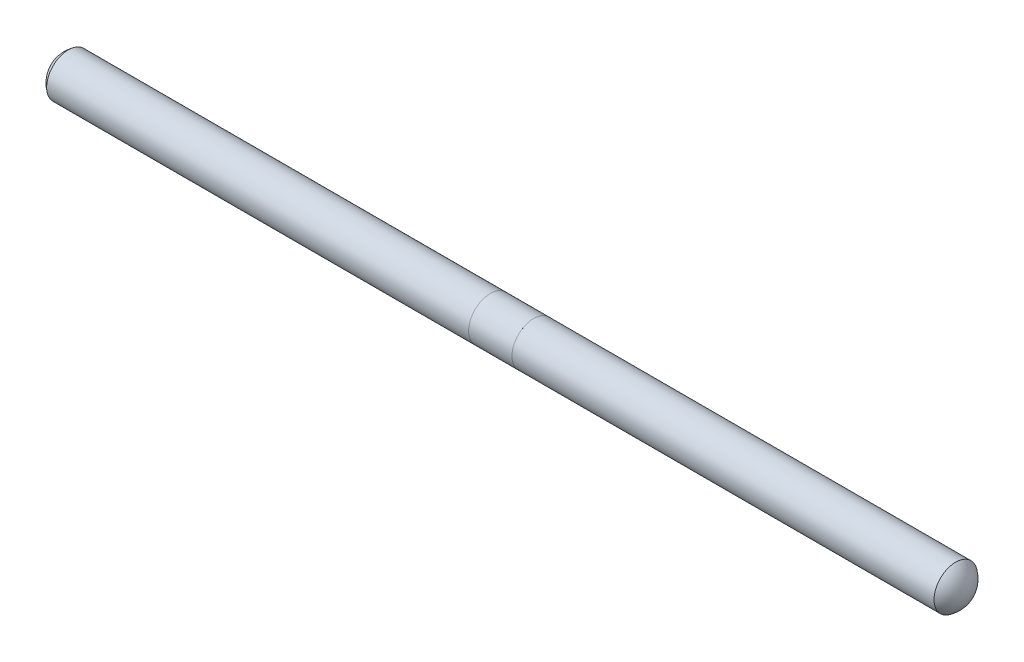
from build123d import *

# Parameters (mm, degrees)
SKETCH1_R           = 5
BOSS_EXTRUDE1_DEPTH = 210
SPLIT6_START        = 100
SPLIT6_OUTLINE_R    = 5
SPLIT6_DEPTH        = 110
SPLIT6_3_OUTLINE_R  = 5
SPLIT6_3_DEPTH      = 10


# Read off the part's stored shape, not the designer's step: Split3, Split6
with BuildPart() as part:
    # Sketch1 → Boss-Extrude1 (new body)
    with BuildSketch(Plane(origin=(0, 0, 0), x_dir=(0, 0, -1), z_dir=(1, 0, 0))):
        Circle(SKETCH1_R)
    extrude(amount=BOSS_EXTRUDE1_DEPTH)

    # Split3 outline → Split3 (revolve, cut)
    with BuildSketch(Plane.YX):
        with BuildLine():
            ThreePointArc((5.000000003, 2.683375215), (2.837274334, 0.713235928), (0, 0))
            Line((0, 0), (5, 0))
            Line((5, 0), (5.000000003, 2.683375215))
        make_face()
    revolve(axis=Axis((0, 0, 0), (1, 0, 0)), mode=Mode.SUBTRACT)

    # SurfaceCut2: cut with a surface, the side behind it stays
    # Surface-Revolve4: a surface, the sketch's curves turned about an axis
    with BuildLine(Plane.XY, mode=Mode.PRIVATE) as surface_revolve4_1_path:
        ThreePointArc((210, 0), (209.286764074, 2.837274331), (207.31662479, 5))
    surface_revolve4_1 = Shell.revolve(surface_revolve4_1_path.wire(), 360, Axis((220.5, 0, 0), (-1, 0, 0)))
    split(bisect_by=surface_revolve4_1, keep=Keep.BOTTOM)

    # Split6 outline → Split6 (cut)
    with BuildSketch(Plane.YZ.offset(SPLIT6_START)):
        Circle(SPLIT6_OUTLINE_R)
    extrude(amount=SPLIT6_DEPTH, mode=Mode.SUBTRACT)


with BuildPart() as body_2:
    # Split6 2 outline → Split6 2 (revolve)
    with BuildSketch(Plane.YX):
        with BuildLine():
            Line((0, 210), (0, 110))
            Line((0, 110), (5, 110))
            Line((5, 110), (5.000000003, 207.316624785))
            ThreePointArc((5.000000003, 207.316624785), (2.837274334, 209.286764072), (0, 210))
        make_face()
    revolve(axis=Axis((0, 0, 0), (1, 0, 0)))


with BuildPart() as body_3:
    # Split6 3 outline → Split6 3 (new body)
    with BuildSketch(Plane.YZ.offset(SPLIT6_START)):
        Circle(SPLIT6_3_OUTLINE_R)
    extrude(amount=SPLIT6_3_DEPTH)


solid = Compound([part.part, body_2.part, body_3.part])
